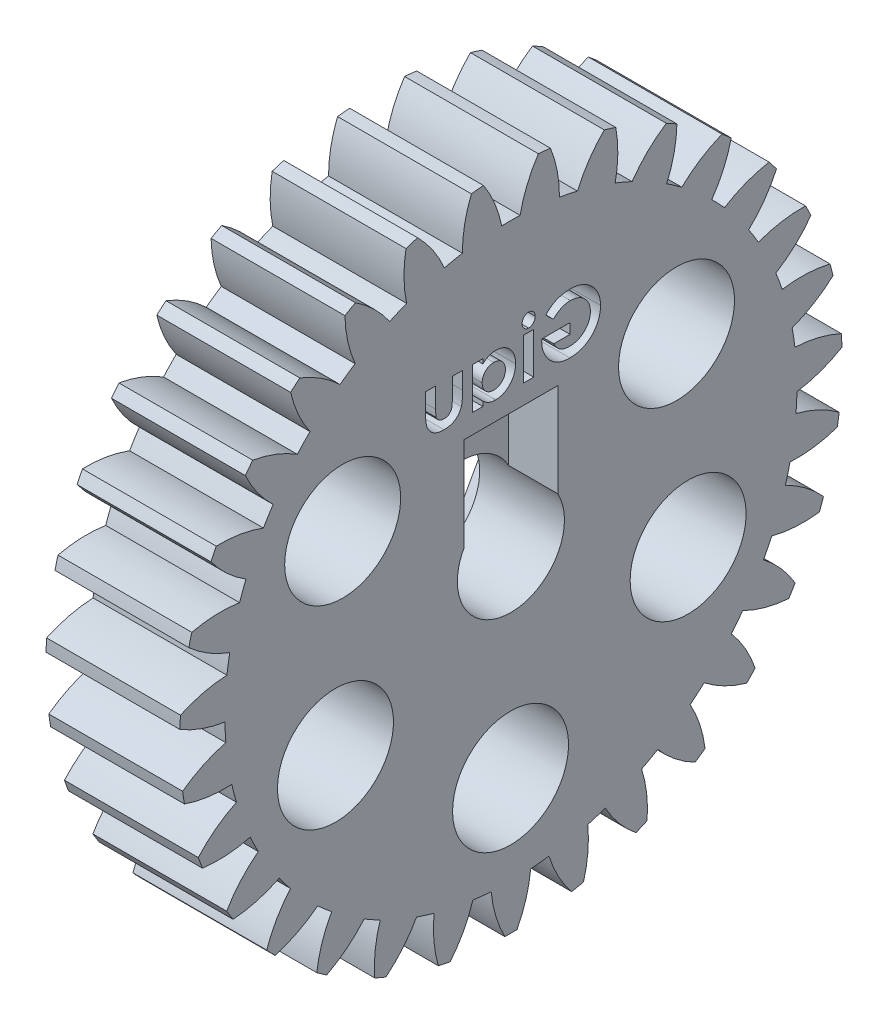
from build123d import *

# Parameters (mm, degrees)
BASPROSKE_W        = 15
BASPROSKE_H        = 37.125
TOOTHCUT_DEPTH     = 55.603399619
TEETHCUTS_COUNT    = 31
BORSKE_R           = 6
BORE_DEPTH         = 50.0000508
CUT_EXTRUDE1_DEPTH = 5.5
SKETCH1_W          = 1.13974359
SKETCH1_H          = 4.640384615
CUT_EXTRUDE3_DEPTH = 55.590168897
CUT_EXTRUDE5_DEPTH = 5.5
SKETCH10_R         = 6.5
CUT_EXTRUDE6_DEPTH = 55.590169061


with BuildPart() as part:
    # BasProSke → Base-Revolve (revolve)
    with BuildSketch(Plane(origin=(0, 0, 0), x_dir=(1, 0, 0), z_dir=(0, 1, 0))):
        with Locations((7.5, 18.5625)):
            Rectangle(BASPROSKE_W, BASPROSKE_H)
    revolve(axis=Axis((-10, 0, 0), (1, 0, 0)))

    # TooCutSke → ToothCut (cut, through all)
    with BuildSketch(Plane(origin=(0, 0, 0), x_dir=(0, 0, -1), z_dir=(1, 0, 0))):
        with BuildLine():
            ThreePointArc((1.030914544, 32.044921555), (0, 32.0615), (-1.030914544, 32.044921555))
            ThreePointArc((-1.030914544, 32.044921555), (-1.820854389, 34.633687107), (-3.095833874, 37.021183568))
            ThreePointArc((-3.095833874, 37.021183568), (0, 37.1504), (3.095833874, 37.021183568))
            ThreePointArc((3.095833874, 37.021183568), (1.820854389, 34.633687107), (1.030914544, 32.044921555))
        make_face()
    toothcut = extrude(amount=TOOTHCUT_DEPTH, mode=Mode.SUBTRACT)

    # TeethCuts: ToothCut ×31 about axis
    teethcuts_axis = Axis((-10, 0, 0), (1, 0, 0))
    for i in range(1, TEETHCUTS_COUNT):
        add(toothcut.rotate(teethcuts_axis, i * 360 / TEETHCUTS_COUNT), mode=Mode.SUBTRACT)

    # BorSke → Bore (cut, symmetric)
    with BuildSketch(Plane(origin=(0, 0, 0), x_dir=(0, 0, -1), z_dir=(1, 0, 0))):
        Circle(BORSKE_R)
    extrude(amount=BORE_DEPTH, both=True, mode=Mode.SUBTRACT)

    # Sketch2 → Cut-Extrude1 (cut)
    with BuildSketch(Plane(origin=(15, 0, 0), x_dir=(0, 0, -1), z_dir=(1, 0, 0))):
        with BuildLine():
            Line((-5.25, 2.90473751), (-5.25, 13.40473751))
            Line((-5.25, 13.40473751), (5.25, 13.40473751))
            Line((5.25, 13.40473751), (5.25, 2.90473751))
            ThreePointArc((5.25, 2.90473751), (0, -6), (-5.25, 2.90473751))
        make_face()
    extrude(amount=-CUT_EXTRUDE1_DEPTH, mode=Mode.SUBTRACT)

    # Sketch1 → Cut-Extrude3 (cut, through all)
    # profile 1 of 5: a face of its own
    with BuildSketch(Plane.ZY):
        with BuildLine():
            Line((-3.901072378, 20.915399906), (-4.763512282, 20.089849025))
            add(Edge.make_bspline(
                [(-4.763512282, 20.089849025), (-4.831793154, 20.158211709), (-4.965771498, 20.292350583), (-5.184876319, 20.466941545), (-5.411802417, 20.615378378), (-5.647296698, 20.737433525), (-5.891687205, 20.832110109), (-6.144491652, 20.899835299), (-6.40612132, 20.940004257), (-6.583232926, 20.945627774), (-6.672837202, 20.948472823)],
                knots=[0, 0, 0, 0, 1.075575784, 2.110457258, 3.113929901, 4.09197124, 5.059417775, 6.02750972, 7.002078037, 8, 8, 8, 8], degree=3))
            add(Edge.make_bspline(
                [(-6.672837202, 20.948472823), (-6.750521369, 20.94647931), (-6.903061041, 20.942564873), (-7.127203397, 20.912838903), (-7.341385149, 20.863183008), (-7.546618179, 20.794393056), (-7.741649468, 20.704875588), (-7.927609065, 20.596012199), (-8.103352571, 20.466970077), (-8.267496134, 20.32019541), (-8.416949377, 20.159947108), (-8.547429949, 19.98842476), (-8.658571365, 19.808825398), (-8.750063417, 19.620230164), (-8.819678919, 19.422928515), (-8.869375278, 19.217063681), (-8.900920108, 19.003233934), (-8.90464461, 18.857357066), (-8.906531112, 18.783468816)],
                knots=[0, 0, 0, 0, 1.075001177, 2.110859044, 3.123021556, 4.114053297, 5.101481495, 6.087880186, 7.091499647, 8.114004866, 9.131394192, 10.11971144, 11.092043119, 12.050101265, 13.015322563, 13.981809771, 14.977764287, 16, 16, 16, 16], degree=3))
            add(Edge.make_bspline(
                [(-8.906531112, 18.783468816), (-8.904771473, 18.707023195), (-8.901304745, 18.556414856), (-8.868002897, 18.335390644), (-8.816695668, 18.122749424), (-8.741595564, 17.920068947), (-8.64917008, 17.724572771), (-8.531959338, 17.540047844), (-8.395279884, 17.363676269), (-8.239375945, 17.198528775), (-8.06979272, 17.04630253), (-7.88612857, 16.914988253), (-7.693971684, 16.801692377), (-7.490220642, 16.711965705), (-7.278411958, 16.639925018), (-7.056397284, 16.589130151), (-6.824676543, 16.557967676), (-6.666575571, 16.55422062), (-6.586338804, 16.552318977)],
                knots=[0, 0, 0, 0, 1.022067601, 2.013613092, 2.983553406, 3.943623673, 4.90013463, 5.87121881, 6.861774014, 7.881098904, 8.905697761, 9.905387765, 10.89678721, 11.884561068, 12.87834324, 13.885584958, 14.926927371, 16, 16, 16, 16], degree=3))
            add(Edge.make_bspline(
                [(-6.586338804, 16.552318977), (-6.534147759, 16.552789887), (-6.431685124, 16.55371439), (-6.2813899, 16.568721668), (-6.137443175, 16.590176316), (-5.999287482, 16.618579722), (-5.868317824, 16.658775638), (-5.742720837, 16.705779813), (-5.623232407, 16.761254111), (-5.510500388, 16.8271125), (-5.402847002, 16.900931703), (-5.301279905, 16.98539657), (-5.20401749, 17.078602727), (-5.112196256, 17.181688821), (-5.027370304, 17.295576563), (-4.946822027, 17.418173113), (-4.871473687, 17.550695168), (-4.826952342, 17.644275531), (-4.80421741, 17.692062566)],
                knots=[0, 0, 0, 0, 1.109579412, 2.178351274, 3.208885622, 4.204702371, 5.174744997, 6.119429583, 7.05542196, 7.97267548, 8.893247984, 9.828544973, 10.778894627, 11.756245826, 12.760884819, 13.796418446, 14.874735809, 16, 16, 16, 16], degree=3))
            Line((-4.80421741, 17.692062566), (-6.627043932, 17.692062566))
            Line((-6.627043932, 17.692062566), (-6.627043932, 18.831806156))
            Line((-6.627043932, 18.831806156), (-3.460948179, 18.831806156))
            Line((-3.460948179, 18.831806156), (-3.452043932, 18.560862647))
            add(Edge.make_bspline(
                [(-3.452043932, 18.560862647), (-3.453188062, 18.491277479), (-3.455474279, 18.352231324), (-3.476367905, 18.145215287), (-3.510977879, 17.940944888), (-3.558293027, 17.739625291), (-3.617590875, 17.540268953), (-3.693214195, 17.344784875), (-3.781768639, 17.151847349), (-3.880987612, 16.962276212), (-3.99248119, 16.780377551), (-4.112520397, 16.608143531), (-4.239393994, 16.445872252), (-4.375861427, 16.29582456), (-4.519797676, 16.156739987), (-4.671486079, 16.029153609), (-4.831463151, 15.912957472), (-4.99888143, 15.807169983), (-5.174694524, 15.714453491), (-5.357935813, 15.633802443), (-5.548328627, 15.565307211), (-5.746364517, 15.509156021), (-5.951653796, 15.465830911), (-6.164200863, 15.436122826), (-6.384122451, 15.415935849), (-6.533290612, 15.413709083), (-6.609235439, 15.412575387)],
                knots=[0, 0, 0, 0, 1.006889344, 2.011981806, 3.007738725, 4.003571281, 5.003404394, 6.015442001, 7.03424805, 8.074616296, 9.110249922, 10.119753985, 11.111721717, 12.089233633, 13.052717867, 14.006597561, 14.955430184, 15.912305663, 16.870361111, 17.829300583, 18.807640451, 19.796414044, 20.806216501, 21.841577364, 22.90109906, 24, 24, 24, 24], degree=3))
            add(Edge.make_bspline(
                [(-6.609235439, 15.412575387), (-6.69026342, 15.413694933), (-6.850885045, 15.415914206), (-7.088385646, 15.436699215), (-7.318996207, 15.471003529), (-7.542774247, 15.518479528), (-7.760239334, 15.577567202), (-7.971017829, 15.651736209), (-8.174678634, 15.739962588), (-8.371831617, 15.839910071), (-8.559956948, 15.953259223), (-8.738633008, 16.078022453), (-8.906884549, 16.215002306), (-9.066434989, 16.361905709), (-9.213556612, 16.522343563), (-9.353732067, 16.691115297), (-9.480170333, 16.874410786), (-9.598307879, 17.066287537), (-9.703262219, 17.266665142), (-9.795046298, 17.471837515), (-9.873319709, 17.680616707), (-9.935040185, 17.893974863), (-9.985151431, 18.110424272), (-10.021006969, 18.330906223), (-10.041256266, 18.555393115), (-10.044594463, 18.706259935), (-10.046274702, 18.782196781)],
                knots=[0, 0, 0, 0, 1.084149091, 2.14910686, 3.187506334, 4.202448172, 5.208724393, 6.201130722, 7.189831603, 8.176984443, 9.156919086, 10.126598231, 11.090766514, 12.05840148, 13.026036446, 14.001772938, 14.991905635, 16.003017641, 17.015720547, 18.016462227, 19.009322657, 19.99686681, 20.986544154, 21.980959929, 22.983742515, 24, 24, 24, 24], degree=3))
            add(Edge.make_bspline(
                [(-10.046274702, 18.782196781), (-10.044024504, 18.885790867), (-10.03958103, 19.090358472), (-9.998427723, 19.391687852), (-9.934275849, 19.683193961), (-9.84221145, 19.963815153), (-9.724071086, 20.233937987), (-9.581528322, 20.494196589), (-9.41148682, 20.744314328), (-9.279863019, 20.899171946), (-9.213091609, 20.977729634)],
                knots=[0, 0, 0, 0, 1.034044851, 2.041932006, 3.031217818, 4.011390712, 4.986069675, 5.97149666, 6.970960976, 8, 8, 8, 8], degree=3))
            add(Edge.make_bspline(
                [(-9.213091609, 20.977729634), (-9.171633893, 21.023177637), (-9.08934095, 21.113391241), (-8.95779583, 21.238744878), (-8.82291469, 21.356581935), (-8.682829403, 21.46440375), (-8.538276372, 21.564570595), (-8.388839548, 21.655204762), (-8.235302842, 21.739192092), (-8.076468854, 21.812243873), (-7.913169101, 21.877740888), (-7.744680355, 21.933160572), (-7.572264561, 21.982249239), (-7.394394973, 22.019593125), (-7.212868496, 22.050690264), (-7.026396597, 22.071533194), (-6.835487421, 22.086809579), (-6.706366056, 22.087743759), (-6.64103632, 22.088216413)],
                knots=[0, 0, 0, 0, 1.020590567, 2.025856924, 3.013483481, 3.991664875, 4.957826714, 5.930500614, 6.890802512, 7.860442893, 8.829981142, 9.809047939, 10.802672283, 11.803273349, 12.823572789, 13.857849586, 14.916166035, 16, 16, 16, 16], degree=3))
            add(Edge.make_bspline(
                [(-6.64103632, 22.088216413), (-6.572745536, 22.087163251), (-6.436871951, 22.085067847), (-6.234850431, 22.070569016), (-6.035636135, 22.048200737), (-5.840068573, 22.014647042), (-5.647491418, 21.973268352), (-5.458901495, 21.920252009), (-5.27306849, 21.860015893), (-5.152091907, 21.811991211), (-5.091697378, 21.788016092)],
                knots=[0, 0, 0, 0, 1.03180557, 2.052914215, 3.058998889, 4.059601663, 5.049854447, 6.033765722, 7.018406786, 8, 8, 8, 8], degree=3))
            add(Edge.make_bspline(
                [(-5.091697378, 21.788016092), (-5.040882853, 21.765858766), (-4.937527514, 21.720791378), (-4.787158235, 21.638338479), (-4.636421563, 21.546929976), (-4.486944023, 21.443223764), (-4.338953377, 21.32741382), (-4.190904445, 21.201329344), (-4.044308563, 21.063500117), (-3.94943611, 20.965405977), (-3.901072378, 20.915399906)],
                knots=[0, 0, 0, 0, 0.894392155, 1.819168899, 2.76525314, 3.739198753, 4.75366411, 5.797420238, 6.877176959, 8, 8, 8, 8], degree=3))
        make_face()
    # profile 2 of 5: a face of its own
    with BuildSketch(Plane.ZY):
        with BuildLine():
            add(Edge.make_bspline(
                [(-1.989203387, 22.169626669), (-1.940080447, 22.167216512), (-1.84362282, 22.162483935), (-1.705434144, 22.116351845), (-1.578604945, 22.043948906), (-1.466484416, 21.94461035), (-1.373233044, 21.825981943), (-1.301985532, 21.693169556), (-1.262296512, 21.546017707), (-1.256784294, 21.44436675), (-1.253967009, 21.392413127)],
                knots=[0, 0, 0, 0, 0.989868614, 1.943702388, 2.910836514, 3.924849579, 4.949916355, 5.946401046, 6.950409252, 8, 8, 8, 8], degree=3))
            add(Edge.make_bspline(
                [(-1.253967009, 21.392413127), (-1.256683496, 21.340842374), (-1.261976701, 21.240354307), (-1.302899, 21.095200113), (-1.371286883, 20.962452233), (-1.465293533, 20.845585679), (-1.576198529, 20.747847028), (-1.700256413, 20.674129658), (-1.837120841, 20.630563885), (-1.932081737, 20.625435692), (-1.980299141, 20.622831797)],
                knots=[0, 0, 0, 0, 1.05296456, 2.051751585, 3.055639087, 4.085634717, 5.099016424, 6.062201612, 7.016062274, 8, 8, 8, 8], degree=3))
            add(Edge.make_bspline(
                [(-1.980299141, 20.622831797), (-2.029850884, 20.625233339), (-2.127147688, 20.62994886), (-2.266469796, 20.67618889), (-2.394990573, 20.748021608), (-2.506624724, 20.849389805), (-2.600944032, 20.968861156), (-2.669079424, 21.104765531), (-2.711699797, 21.2529236), (-2.716758798, 21.356080078), (-2.719351625, 21.408949586)],
                knots=[0, 0, 0, 0, 0.989065327, 1.942068821, 2.907541208, 3.917690034, 4.939857478, 5.938239964, 6.943311734, 8, 8, 8, 8], degree=3))
            add(Edge.make_bspline(
                [(-2.719351625, 21.408949586), (-2.71652992, 21.459644636), (-2.710987089, 21.559227745), (-2.671060327, 21.703107976), (-2.601446519, 21.83368758), (-2.508866846, 21.950144382), (-2.397731112, 22.047629901), (-2.270978051, 22.117833915), (-2.133719389, 22.162060619), (-2.037872787, 22.167078611), (-1.989203387, 22.169626669)],
                knots=[0, 0, 0, 0, 1.038616768, 2.040212704, 3.031499824, 4.052181184, 5.074969369, 6.039807101, 7.004644834, 8, 8, 8, 8], degree=3))
        make_face()
    # profile 3 of 5: a face of its own
    with BuildSketch(Plane.ZY):
        with Locations((-1.986659317, 17.895588208)):
            Rectangle(SKETCH1_W, SKETCH1_H)
    # profile 4 of 5: a face of its own
    with BuildSketch(Plane.ZY):
        with BuildLine():
            Line((3.142186837, 20.215780515), (4.281930427, 20.215780515))
            Line((4.281930427, 20.215780515), (4.281930427, 15.5753959))
            Line((4.281930427, 15.5753959), (3.142186837, 15.5753959))
            Line((3.142186837, 15.5753959), (3.142186837, 16.081665932))
            add(Edge.make_bspline(
                [(3.142186837, 16.081665932), (3.085712962, 16.032386147), (2.976108323, 15.936743818), (2.803406878, 15.812645463), (2.63020078, 15.710280359), (2.455657768, 15.628752137), (2.27709519, 15.568551935), (2.093227466, 15.524965584), (1.901406705, 15.499261646), (1.771009595, 15.49576263), (1.704786997, 15.493985643)],
                knots=[0, 0, 0, 0, 1.129196829, 2.191548051, 3.199897424, 4.157751732, 5.089409408, 6.034969131, 7.002052659, 8, 8, 8, 8], degree=3))
            add(Edge.make_bspline(
                [(1.704786997, 15.493985643), (1.630449187, 15.495658012), (1.483553461, 15.498962706), (1.268000291, 15.533749946), (1.059862276, 15.586999571), (0.859308367, 15.662354446), (0.666703451, 15.759999592), (0.480573518, 15.877387309), (0.304109403, 16.018638609), (0.135842101, 16.177641908), (-0.018222431, 16.352546668), (-0.1529071, 16.540925235), (-0.266436266, 16.740105876), (-0.359444637, 16.949428213), (-0.432607731, 17.168738618), (-0.484762548, 17.398732675), (-0.51553395, 17.639492527), (-0.519342583, 17.80348871), (-0.521274702, 17.886683961)],
                knots=[0, 0, 0, 0, 0.980476535, 1.937477201, 2.874147792, 3.812856188, 4.758993464, 5.720109578, 6.712210464, 7.737600662, 8.772720504, 9.783789959, 10.789002326, 11.793715968, 12.802552247, 13.835794126, 14.902098527, 16, 16, 16, 16], degree=3))
            add(Edge.make_bspline(
                [(-0.521274702, 17.886683961), (-0.519246935, 17.972832752), (-0.515269246, 18.141823206), (-0.486172688, 18.389808661), (-0.434980323, 18.625505402), (-0.365175855, 18.849239903), (-0.275384526, 19.061050815), (-0.166024688, 19.261285154), (-0.035608602, 19.449419538), (0.114672818, 19.622251789), (0.276939841, 19.780660894), (0.450536869, 19.918568583), (0.632749224, 20.035727582), (0.82377054, 20.13137479), (1.023573536, 20.205286112), (1.231369395, 20.259321324), (1.448080583, 20.291744349), (1.595706, 20.29536022), (1.670442045, 20.297190772)],
                knots=[0, 0, 0, 0, 1.136281865, 2.228943489, 3.287578264, 4.313574083, 5.316051562, 6.317280042, 7.318008486, 8.329309503, 9.333984563, 10.305318864, 11.248632312, 12.186624717, 13.117503092, 14.05354244, 15.014596925, 16, 16, 16, 16], degree=3))
            add(Edge.make_bspline(
                [(1.670442045, 20.297190772), (1.739671839, 20.295752508), (1.876652647, 20.292906703), (2.077994699, 20.262006707), (2.273267449, 20.215272658), (2.461405676, 20.14868505), (2.643952552, 20.064604649), (2.817768155, 19.959245638), (2.986654857, 19.837036211), (3.0897023, 19.74158806), (3.142186837, 19.692974025)],
                knots=[0, 0, 0, 0, 1.017011718, 2.012299608, 2.98747302, 3.965332399, 4.941441765, 5.936729654, 6.94912688, 8, 8, 8, 8], degree=3))
            Line((3.142186837, 19.692974025), (3.142186837, 20.215780515))
        make_face()
        with BuildLine():
            add(Edge.make_bspline(
                [(1.909584673, 19.238857438), (1.864169251, 19.237463936), (1.775157989, 19.234732764), (1.644254746, 19.218304569), (1.519150516, 19.189357357), (1.400737531, 19.146594069), (1.287251003, 19.094502153), (1.180414242, 19.029257886), (1.079345494, 18.952140548), (0.984639153, 18.86501715), (0.898300369, 18.769252606), (0.823871298, 18.66475274), (0.760618612, 18.554333229), (0.707123279, 18.43766208), (0.668832758, 18.313358713), (0.638506681, 18.183041336), (0.62276941, 18.045645323), (0.619916739, 17.952014193), (0.618468888, 17.904492454)],
                knots=[0, 0, 0, 0, 1.04836806, 2.054732945, 3.03993516, 4.00574415, 4.955904794, 5.917688631, 6.888591924, 7.88601754, 8.884115178, 9.859153345, 10.841239365, 11.818093293, 12.814750328, 13.83810466, 14.90274714, 16, 16, 16, 16], degree=3))
            add(Edge.make_bspline(
                [(0.618468888, 17.904492454), (0.619894622, 17.856539666), (0.622704015, 17.762049252), (0.638761137, 17.623494255), (0.667995957, 17.491273247), (0.710648456, 17.366455146), (0.762737052, 17.247355743), (0.826140586, 17.134524692), (0.904020724, 17.029956988), (0.990435193, 16.931178208), (1.08708442, 16.842972591), (1.188725056, 16.764654101), (1.296745433, 16.699125071), (1.409973606, 16.646164094), (1.528028443, 16.60300535), (1.652389994, 16.574421946), (1.781839982, 16.556149116), (1.870089456, 16.553604506), (1.914672814, 16.552318977)],
                knots=[0, 0, 0, 0, 1.099136573, 2.165835871, 3.191374663, 4.196217796, 5.183857741, 6.167377911, 7.154730987, 8.166690795, 9.170734848, 10.148332609, 11.103258353, 12.059567475, 13.009337315, 13.978056681, 14.978520572, 16, 16, 16, 16], degree=3))
            add(Edge.make_bspline(
                [(1.914672814, 16.552318977), (1.960934152, 16.553720291), (2.051631522, 16.556467629), (2.184670385, 16.572745898), (2.311455214, 16.601799247), (2.431458517, 16.644807365), (2.546513229, 16.696525364), (2.655581085, 16.760494709), (2.757478535, 16.837435083), (2.852721643, 16.92534608), (2.93999359, 17.021892599), (3.015451956, 17.127762814), (3.081178954, 17.239570707), (3.132870213, 17.359959823), (3.173920322, 17.486823914), (3.203372829, 17.620950326), (3.219393285, 17.762483664), (3.222178107, 17.859085682), (3.223597093, 17.90830856)],
                knots=[0, 0, 0, 0, 1.050008698, 2.058587853, 3.036635738, 3.995319155, 4.947022481, 5.895997462, 6.858296291, 7.838991643, 8.833936038, 9.806048392, 10.784806122, 11.771666913, 12.772873988, 13.80724452, 14.882696879, 16, 16, 16, 16], degree=3))
            add(Edge.make_bspline(
                [(3.223597093, 17.90830856), (3.222195739, 17.956684828), (3.219458487, 18.051177733), (3.203303737, 18.189755921), (3.173642134, 18.321248703), (3.133436904, 18.445897779), (3.080826041, 18.563418141), (3.015049313, 18.672506768), (2.940418682, 18.776943172), (2.852180508, 18.870881435), (2.757453354, 18.958155888), (2.654057337, 19.03276953), (2.545249992, 19.097073637), (2.430362806, 19.149869788), (2.308331974, 19.188571369), (2.181330478, 19.218536587), (2.047376831, 19.234722904), (1.95626493, 19.23745677), (1.909584673, 19.238857438)],
                knots=[0, 0, 0, 0, 1.106611376, 2.161533483, 3.185006901, 4.184773755, 5.152708835, 6.122342771, 7.094156588, 8.082475533, 9.064254463, 10.03606828, 10.992420271, 11.951521816, 12.920622147, 13.915721683, 14.932141191, 16, 16, 16, 16], degree=3))
        make_face(mode=Mode.SUBTRACT)
    # profile 5 of 5: a face of its own
    with BuildSketch(Plane.ZY):
        with BuildLine():
            Line((5.421674016, 20.215780515), (6.561417606, 20.215780515))
            Line((6.561417606, 20.215780515), (6.561417606, 17.988446781))
            add(Edge.make_bspline(
                [(6.561417606, 17.988446781), (6.561518816, 17.936288001), (6.561713062, 17.836182566), (6.567118305, 17.692411562), (6.574702928, 17.560939562), (6.584168026, 17.441611537), (6.59829529, 17.33471451), (6.614604621, 17.240452551), (6.633094141, 17.158146491), (6.663160435, 17.066405414), (6.710199695, 16.96601245), (6.781237305, 16.859433529), (6.867284569, 16.767273925), (6.967178933, 16.68871577), (7.081940561, 16.62681022), (7.209988341, 16.584857772), (7.34971117, 16.556661366), (7.447027911, 16.553804588), (7.497635555, 16.552318977)],
                knots=[0, 0, 0, 0, 1.267339619, 2.432334223, 3.495366327, 4.467371443, 5.340232306, 6.114347373, 6.791623365, 7.387877112, 8.457231658, 9.474542289, 10.487879852, 11.508108106, 12.54995813, 13.638205937, 14.771795776, 16, 16, 16, 16], degree=3))
            add(Edge.make_bspline(
                [(7.497635555, 16.552318977), (7.548198289, 16.554014591), (7.645766707, 16.557286536), (7.786419166, 16.582802027), (7.914768548, 16.626523672), (8.032133084, 16.685826923), (8.135051687, 16.765194223), (8.224658705, 16.859765992), (8.300105712, 16.971067788), (8.336361478, 17.054095739), (8.354987318, 17.096750066)],
                knots=[0, 0, 0, 0, 1.116871431, 2.155171802, 3.144773418, 4.104381479, 5.046960687, 6.001340237, 6.973219418, 8, 8, 8, 8], degree=3))
            add(Edge.make_bspline(
                [(8.354987318, 17.096750066), (8.361822375, 17.115697501), (8.376909976, 17.157521778), (8.390338239, 17.229674411), (8.40479105, 17.31476676), (8.416223736, 17.414532934), (8.422692753, 17.528355072), (8.429623642, 17.65637663), (8.433155748, 17.798470105), (8.433613796, 17.898130922), (8.433853504, 17.950285723)],
                knots=[0, 0, 0, 0, 0.56094539, 1.238222264, 2.041156151, 2.969685991, 4.036367568, 5.220421584, 6.545382566, 8, 8, 8, 8], degree=3))
            Line((8.433853504, 17.950285723), (8.433853504, 20.215780515))
            Line((8.433853504, 20.215780515), (9.573597093, 20.215780515))
            Line((9.573597093, 20.215780515), (9.573597093, 18.265750467))
            add(Edge.make_bspline(
                [(9.573597093, 18.265750467), (9.573399748, 18.169063842), (9.573021377, 17.983686318), (9.562177495, 17.717768283), (9.54721171, 17.475995714), (9.527938657, 17.257702935), (9.50016857, 17.062799352), (9.466079308, 16.89174202), (9.4283657, 16.743400568), (9.393780917, 16.655507233), (9.377703664, 16.614648704)],
                knots=[0, 0, 0, 0, 1.388070971, 2.661352173, 3.82033814, 4.865898334, 5.806910977, 6.645039373, 7.370126333, 8, 8, 8, 8], degree=3))
            add(Edge.make_bspline(
                [(9.377703664, 16.614648704), (9.357096767, 16.570672304), (9.316420522, 16.483866668), (9.245839676, 16.360448278), (9.169749571, 16.243519131), (9.08452981, 16.135831625), (8.991919993, 16.036291288), (8.894537908, 15.942635329), (8.787997972, 15.858677557), (8.67506316, 15.782257503), (8.554157622, 15.714420065), (8.426109473, 15.654304605), (8.28953495, 15.605380929), (8.145618316, 15.563911213), (7.993696208, 15.532985113), (7.834074657, 15.509560951), (7.666578595, 15.497455255), (7.552349383, 15.49516113), (7.493819449, 15.493985643)],
                knots=[0, 0, 0, 0, 0.997311338, 1.968606903, 2.91805772, 3.860812155, 4.785445165, 5.709667791, 6.633356648, 7.568312411, 8.508286151, 9.478643871, 10.470653671, 11.485274776, 12.552984541, 13.653035246, 14.797438149, 16, 16, 16, 16], degree=3))
            add(Edge.make_bspline(
                [(7.493819449, 15.493985643), (7.430590673, 15.494739164), (7.3068734, 15.496213547), (7.126124191, 15.514268966), (6.953867766, 15.537630332), (6.792027356, 15.577348934), (6.638342784, 15.623364923), (6.494578436, 15.682093564), (6.360146855, 15.751141805), (6.234783529, 15.830100291), (6.11946073, 15.919692593), (6.011614126, 16.016045994), (5.91472547, 16.122994091), (5.825631741, 16.237234285), (5.745327275, 16.359817984), (5.673772215, 16.490309318), (5.610905949, 16.629301827), (5.577363677, 16.726715729), (5.560325859, 16.776197182)],
                knots=[0, 0, 0, 0, 1.211240017, 2.369985978, 3.478996442, 4.539426614, 5.559871561, 6.551301256, 7.510778031, 8.453136967, 9.386094087, 10.30661716, 11.221130616, 12.147659962, 13.080758632, 14.026335491, 14.997475882, 16, 16, 16, 16], degree=3))
            add(Edge.make_bspline(
                [(5.560325859, 16.776197182), (5.548702105, 16.814626372), (5.523661827, 16.897411806), (5.496625999, 17.034991535), (5.475001761, 17.193559875), (5.453966386, 17.373272802), (5.439291724, 17.574431604), (5.42970019, 17.796716814), (5.423219488, 18.04056311), (5.42220435, 18.210200439), (5.421674016, 18.298823384)],
                knots=[0, 0, 0, 0, 0.627914866, 1.352675004, 2.190563461, 3.132055958, 4.183353232, 5.345633452, 6.613289997, 8, 8, 8, 8], degree=3))
            Line((5.421674016, 18.298823384), (5.421674016, 20.215780515))
        make_face()
    extrude(amount=-CUT_EXTRUDE3_DEPTH, mode=Mode.SUBTRACT)


with BuildPart() as cut_extrude3_piece_1:
    # of the separate pieces the step leaves, piece 1, a body of its own (cut_extrude3_pieces)
    add(part.part.solids().sort_by_distance((0, 36.997034521, -3.079782727))[0])

    # Sketch8 → Cut-Extrude5 (cut)
    with BuildSketch(Plane.ZY):
        Polygon((13.854005973, -0.294685119), (7.150361146, 11.832191891), (-6.703644827, 12.090103679), (-13.854005973, 0.221138455), (-7.150361146, -11.905738556), (6.703644827, -12.163650343), align=None)
    extrude(amount=-CUT_EXTRUDE5_DEPTH, mode=Mode.SUBTRACT)

    # Sketch10 → Cut-Extrude6 (cut, through all)
    with BuildSketch(Plane.ZY):
        with Locations((-19.863387595, -9.577864097)):
            Circle(SKETCH10_R)
        with Locations((0.040469936, -22.041338682)):
            Circle(SKETCH10_R)
        with Locations((19.66580652, -10.026222395)):
            Circle(SKETCH10_R)
        with Locations((18.858194519, 11.322709237)):
            Circle(SKETCH10_R)
        with Locations((-18.562453348, 11.784144122)):
            Circle(SKETCH10_R)
    extrude(amount=-CUT_EXTRUDE6_DEPTH, mode=Mode.SUBTRACT)


with BuildPart() as cut_extrude3_piece_2:
    # of the separate pieces the step leaves, piece 2, a body of its own (cut_extrude3_pieces)
    add(part.part.solids().sort_by_distance((0, 17.90830856, 3.223597093))[0])


solid = Compound([cut_extrude3_piece_1.part, cut_extrude3_piece_2.part])
